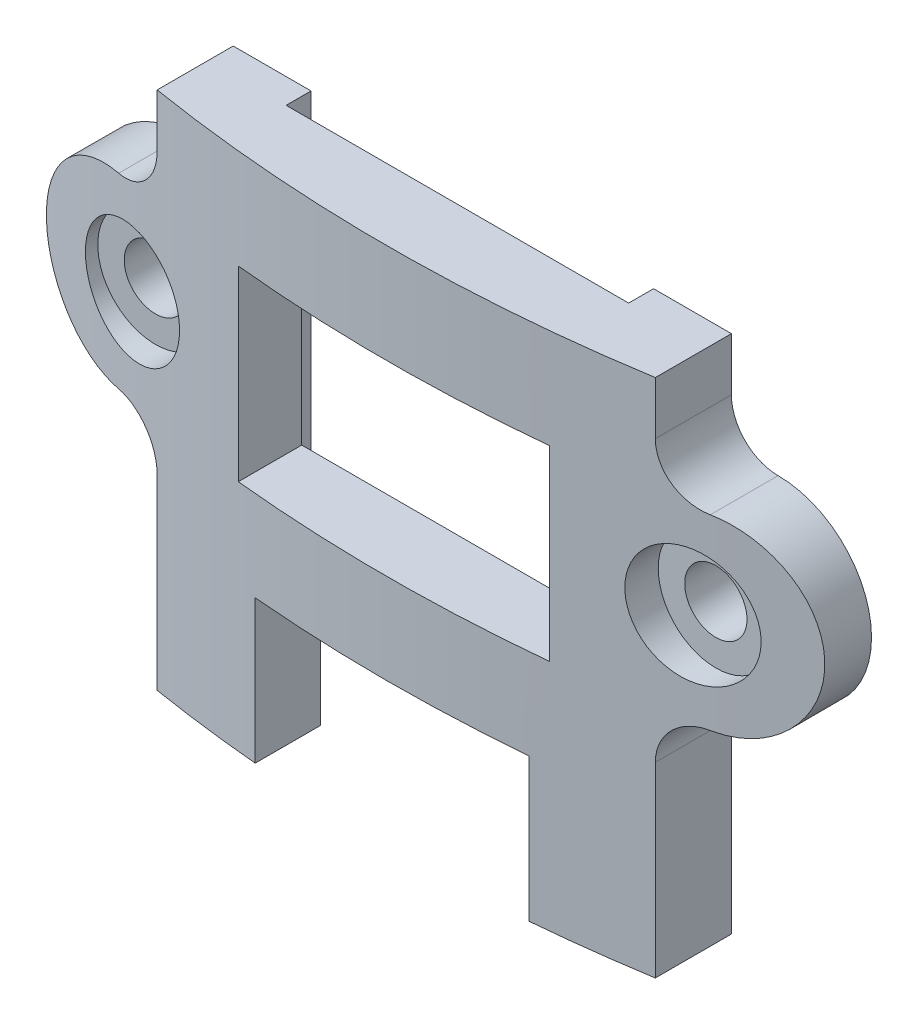
from build123d import *

# Parameters (mm, degrees)
MAIN_DEPTH               = 5.1
SKETCH1_W                = 10
SKETCH1_H                = 6
SENSOR_CUT_DEPTH         = 5.1
MOUNTING_EARS_DEPTH      = 3
SKETCH4_R                = 1
MOUNT_HOLES_DEPTH        = 3
SKETCH9_R                = 1.85
CUT_EXTRUDE1_DEPTH       = 1.5
CIRCULAR_FRONT_CUT_REACH = 23.474
SKETCH6_W                = 11
SKETCH6_H                = 16.7
PCB_CUT_DEPTH            = 0.8
FILLET3_R                = 1.5


with BuildPart() as part:
    # Sketch2 → main (new body)
    with BuildSketch(Plane.XY):
        Polygon((-4.4, -8.35), (-8, -8.35), (-8, 8.35), (8, 8.35), (8, -8.35), (4.4, -8.35), (4.4, -3.75), (-4.4, -3.75), align=None)
    extrude(amount=MAIN_DEPTH)

    # Sketch1 → sensor_cut (cut)
    with BuildSketch(Plane.XY):
        with Locations((0, 2.15)):
            Rectangle(SKETCH1_W, SKETCH1_H)
    extrude(amount=SENSOR_CUT_DEPTH, mode=Mode.SUBTRACT)

    # Sketch3 → mounting_ears (add)
    with BuildSketch(Plane(origin=(0, 0, 0), x_dir=(-1, 0, 0), z_dir=(0, 0, -1))):
        with BuildLine():
            Line((9.5, -0.85), (8, -0.85))
            Line((8, -0.85), (8, 5.15))
            Line((8, 5.15), (9.5, 5.15))
            ThreePointArc((9.5, 5.15), (12.5, 2.15), (9.5, -0.85))
        make_face()
        with BuildLine():
            Line((-8, 5.15), (-9.5, 5.15))
            ThreePointArc((-9.5, 5.15), (-12.5, 2.15), (-9.5, -0.85))
            Line((-9.5, -0.85), (-8, -0.85))
            Line((-8, -0.85), (-8, 5.15))
        make_face()
    extrude(amount=-MOUNTING_EARS_DEPTH)

    # Sketch4 → mount_holes (cut)
    with BuildSketch(Plane.XY.offset(3)):
        with Locations((-9, 2.15)):
            Circle(SKETCH4_R)
    mount_holes = extrude(amount=-MOUNT_HOLES_DEPTH, mode=Mode.SUBTRACT)

    # Sketch9 → Cut-Extrude1 (cut)
    with BuildSketch(Plane.XY.offset(3)):
        with Locations((-9, 2.15)):
            Circle(SKETCH9_R)
    cut_extrude1 = extrude(amount=-CUT_EXTRUDE1_DEPTH, mode=Mode.SUBTRACT)

    # Mirror1: mount_holes, Cut-Extrude1 across plane
    add(mount_holes.mirror(Plane(origin=(0, 0, 0), x_dir=(0, 0, 1), z_dir=(1, 0, 0))), mode=Mode.SUBTRACT)
    add(cut_extrude1.mirror(Plane(origin=(0, 0, 0), x_dir=(0, 0, 1), z_dir=(1, 0, 0))), mode=Mode.SUBTRACT)

    # circular_front_cut: up to this face of the body (flat: up to its plane)
    circular_front_cut_end = Plane(part.part.faces().sort_by_distance((-6.2, -8.35, 2.55))[0])
    # Sketch5 → circular_front_cut (cut, up to the picked face)
    with BuildSketch(Plane(origin=(0, 8.35, 0), x_dir=(1, 0, 0), z_dir=(0, 1, 0)), mode=Mode.PRIVATE) as circular_front_cut_sk1:
        with BuildLine():
            Line((-12.5, -1.5), (-12.5, -9.92320486))
            Line((-12.5, -9.92320486), (12.5, -9.92320486))
            Line((12.5, -9.92320486), (12.5, -1.5))
            ThreePointArc((12.5, -1.5), (0, -3.087708172), (-12.5, -1.5))
        make_face()
    circular_front_cut_tool1 = split(extrude(circular_front_cut_sk1.sketch, amount=-CIRCULAR_FRONT_CUT_REACH, mode=Mode.PRIVATE), bisect_by=circular_front_cut_end, keep=Keep.BOTH, mode=Mode.PRIVATE)
    add(circular_front_cut_tool1.solids().sort_by(Axis((0, 8.35, 6.227394), (0, -1, 0)))[0], mode=Mode.SUBTRACT)

    # Sketch6 → pcb_cut (cut)
    with BuildSketch(Plane(origin=(0, 0, 0), x_dir=(-1, 0, 0), z_dir=(0, 0, -1))):
        Rectangle(SKETCH6_W, SKETCH6_H)
    extrude(amount=-PCB_CUT_DEPTH, mode=Mode.SUBTRACT)

    # Fillet3
    fillet3_edges = [part.edges().sort_by_distance(p)[0] for p in [
        (-8, -0.85, 1.221779445),
        (-8, 5.15, 1.221779445),
        (8, 5.15, 1.221779445),
        (8, -0.85, 1.221779445),
    ]]
    fillet(fillet3_edges, radius=FILLET3_R - 0.0001)  # a hair under: the kernel refuses the full size


solid = part.part
